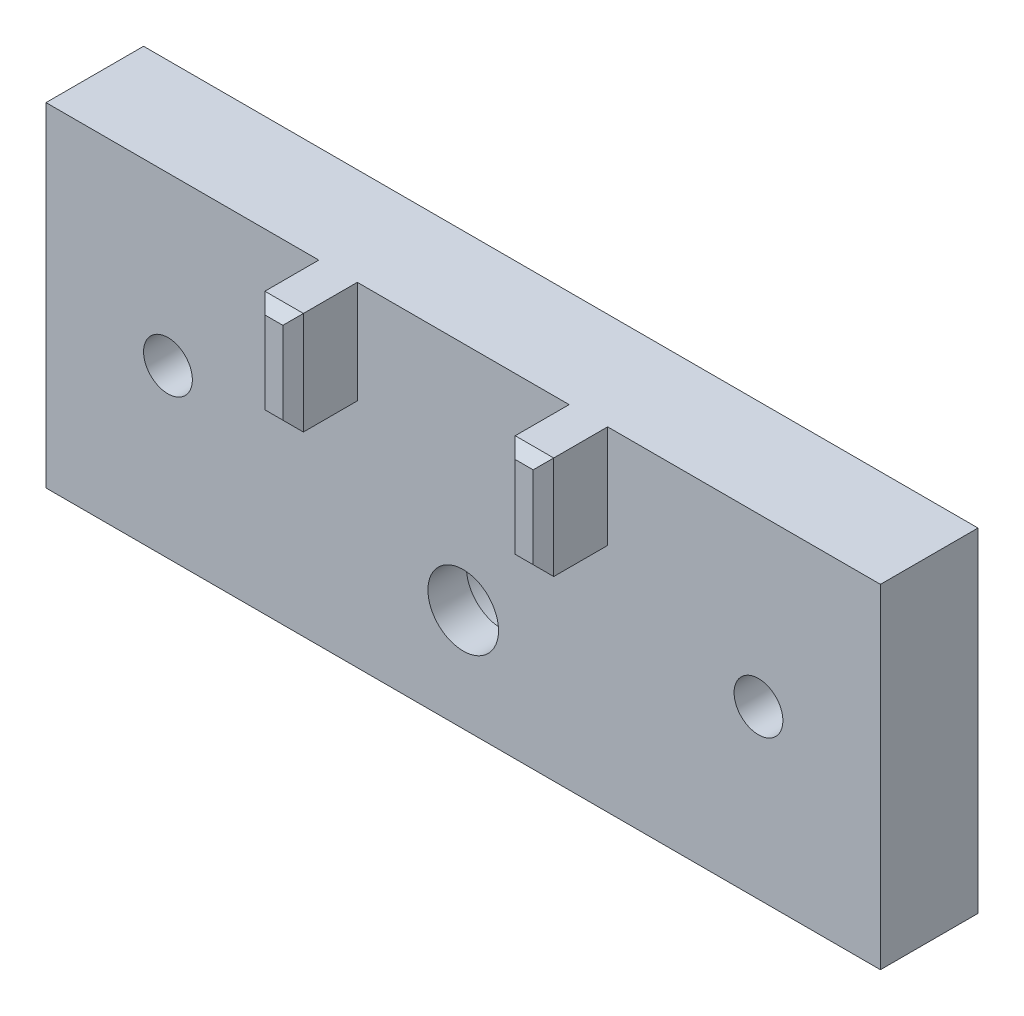
from build123d import *

# Parameters (mm, degrees)
SKETCH1_W           = 65
SKETCH1_H           = 26
BOSS_EXTRUDE1_DEPTH = 8
SKETCH2_R           = 2.75
CUT_EXTRUDE1_DEPTH  = 5
SKETCH3_W           = 3
SKETCH3_H           = 8
BOSS_EXTRUDE2_DEPTH = 5
CHAMFER1_SIZE       = 0.8
SKETCH4_R           = 1.9
CUT_EXTRUDE2_DEPTH  = 8
SKETCH5_R           = 4.5
CUT_EXTRUDE3_DEPTH  = 5
CHAMFER2_SIZE       = 0.4


with BuildPart() as part:
    # Sketch1 → Boss-Extrude1 (new body)
    with BuildSketch(Plane.XY):
        with Locations((32.5, 13)):
            Rectangle(SKETCH1_W, SKETCH1_H)
    extrude(amount=BOSS_EXTRUDE1_DEPTH)

    # Sketch2 → Cut-Extrude1 (cut)
    with BuildSketch(Plane.XY.offset(8)):
        with Locations((32.5, 8)):
            Circle(SKETCH2_R)
    extrude(amount=-CUT_EXTRUDE1_DEPTH, mode=Mode.SUBTRACT)

    # Sketch3 → Boss-Extrude2 (add)
    with BuildSketch(Plane.XY.offset(8)):
        with Locations((22.75, 22)):
            Rectangle(SKETCH3_W, SKETCH3_H)
        with Locations((42.25, 22)):
            Rectangle(SKETCH3_W, SKETCH3_H)
    extrude(amount=BOSS_EXTRUDE2_DEPTH)

    # Chamfer1
    chamfer1_edges = [part.edges().sort_by_distance(p)[0] for p in [
        (42.25, 26, 13),
        (43.75, 22, 13),
        (42.25, 18, 13),
        (40.75, 22, 13),
        (22.75, 26, 13),
        (24.25, 22, 13),
        (22.75, 18, 13),
        (21.25, 22, 13),
    ]]
    chamfer(chamfer1_edges, length=CHAMFER1_SIZE)

    # Sketch4 → Cut-Extrude2 (cut)
    with BuildSketch(Plane(origin=(0, 0, 0), x_dir=(-1, 0, 0), z_dir=(0, 0, -1))):
        with Locations((-55.5, 13)):
            Circle(SKETCH4_R)
        with Locations((-9.5, 13)):
            Circle(SKETCH4_R)
    extrude(amount=-CUT_EXTRUDE2_DEPTH, mode=Mode.SUBTRACT)

    # Sketch5 → Cut-Extrude3 (cut)
    with BuildSketch(Plane(origin=(0, 0, 0), x_dir=(-1, 0, 0), z_dir=(0, 0, -1))):
        with Locations((-32.5, 8)):
            Circle(SKETCH5_R)
    extrude(amount=-CUT_EXTRUDE3_DEPTH, mode=Mode.SUBTRACT)

    # Chamfer2
    chamfer2_edges = [part.edges().sort_by_distance(p)[0] for p in [
        (32.5, 0, 0),
        (65, 13, 0),
        (32.5, 26, 0),
        (0, 13, 0),
        (11.4, 13, 0),
        (57.4, 13, 0),
        (37, 8, 0),
    ]]
    chamfer(chamfer2_edges, length=CHAMFER2_SIZE)


solid = part.part
